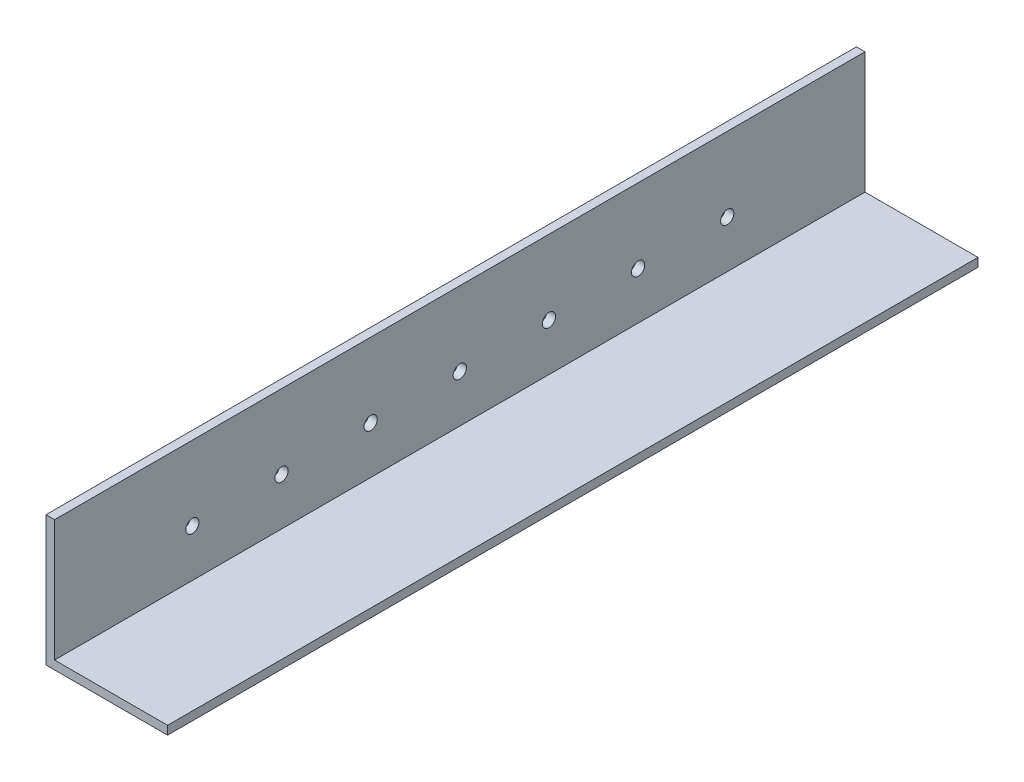
from build123d import *

# Parameters (mm, degrees)
SALIENTE_EXTRUIR1_DEPTH = 150
CROQUIS2_R              = 2.45
CORTAR_EXTRUIR1_DEPTH   = 50


with BuildPart() as part:
    # Croquis1 → Saliente-Extruir1 (new, symmetric)
    with BuildSketch(Plane.XY):
        Polygon((-22.5, -25.675), (22.5, -25.675), (22.5, -22.5), (-19.325, -22.5), (-19.325, 22.5), (-22.5, 22.5), align=None)
    extrude(amount=SALIENTE_EXTRUIR1_DEPTH, both=True)

    # Croquis2 → Cortar-Extruir1 (cut)
    with BuildSketch(Plane(origin=(0, 0, 0), x_dir=(0, 0, -1), z_dir=(1, 0, 0))):
        with Locations((0, -5)):
            Circle(CROQUIS2_R)
        with Locations((33, -5)):
            Circle(CROQUIS2_R)
        with Locations((66, -5)):
            Circle(CROQUIS2_R)
        with Locations((99, -5)):
            Circle(CROQUIS2_R)
        with Locations((-99, -5)):
            Circle(CROQUIS2_R)
        with Locations((-66, -5)):
            Circle(CROQUIS2_R)
        with Locations((-33, -5)):
            Circle(CROQUIS2_R)
    extrude(amount=-CORTAR_EXTRUIR1_DEPTH, mode=Mode.SUBTRACT)


solid = part.part
